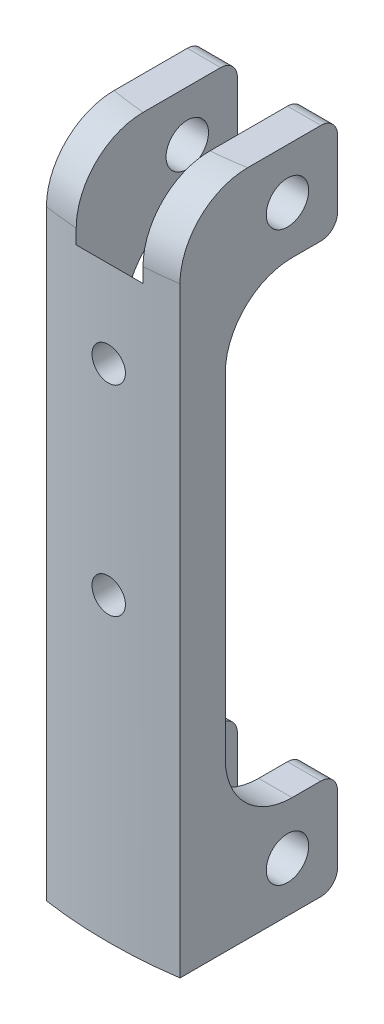
from build123d import *

# Parameters (mm, degrees)
SKETCH1_W               = 5
SKETCH1_H               = 5.034727375
SKETCH1_H_2             = 16.309288723
BOSS_EXTRUDE10_DEPTH    = 100
SKETCH17_W              = 16.809288723
SKETCH17_H              = 70
CUT_EXTRUDE1_DEPTH      = 25
FILLET1_R               = 10
FILLET2_R               = 2.5
FILLET3_R               = 10
SKETCH17_3_R            = 3.175
CUT_EXTRUDE2_DEPTH      = 25
CUT_EXTRUDE3_START      = -7.276812953
CUT_EXTRUDE3_OUTLINE_W  = 10
CUT_EXTRUDE3_OUTLINE_H  = 10
CUT_EXTRUDE3_DEPTH      = 8
CHAMFER1_SIZE           = 10
CUT_EXTRUDE4_DEPTH      = 104.229376725
CUT_EXTRUDE4_DEPTH_BACK = 20
SKETCH20_R              = 2.5


# Read off the part's stored shape, not the designer's step: Cut-Extrude3
with BuildPart() as part:
    # Sketch1 → Boss-Extrude10 (new body)
    with BuildSketch(Plane(origin=(0, 0, 0), x_dir=(1, 0, 0), z_dir=(0, 1, 0))):
        with BuildLine():
            Line((-5, -66.534727375), (-10, -66.534727375))
            Line((-10, -66.534727375), (-10, -66.755149614))
            ThreePointArc((-10, -66.755149614), (-7.505213856, -67.081456193), (-5, -67.314560089))
            Line((-5, -67.314560089), (-5, -66.534727375))
        make_face()
        with BuildLine():
            ThreePointArc((-5, -67.314560089), (-7.505213856, -67.081456193), (-10, -66.755149614))
            Line((-10, -66.755149614), (-10, -68.018839302))
            ThreePointArc((-10, -68.018839302), (-7.505023524, -68.339133166), (-5, -68.56794076))
            Line((-5, -68.56794076), (-5, -67.314560089))
        make_face()
        with BuildLine():
            ThreePointArc((10, -66.755149614), (7.505213856, -67.081456193), (5, -67.314560089))
            Line((5, -67.314560089), (5, -68.56794076))
            ThreePointArc((5, -68.56794076), (7.505023524, -68.339133166), (10, -68.018839302))
            Line((10, -68.018839302), (10, -66.755149614))
        make_face()
        with BuildLine():
            Line((5, -66.534727375), (5, -67.314560089))
            ThreePointArc((5, -67.314560089), (7.505213856, -67.081456193), (10, -66.755149614))
            Line((10, -66.755149614), (10, -66.534727375))
            Line((10, -66.534727375), (5, -66.534727375))
        make_face()
        with BuildLine():
            Line((0, -66.534727375), (-5, -66.534727375))
            Line((-5, -66.534727375), (-5, -67.314560089))
            ThreePointArc((-5, -67.314560089), (0, -67.5), (5, -67.314560089))
            Line((5, -67.314560089), (5, -66.534727375))
            Line((5, -66.534727375), (0, -66.534727375))
        make_face()
        with BuildLine():
            ThreePointArc((5, -67.314560089), (0, -67.5), (-5, -67.314560089))
            Line((-5, -67.314560089), (-5, -68.56794076))
            ThreePointArc((-5, -68.56794076), (0, -68.75), (5, -68.56794076))
            Line((5, -68.56794076), (5, -67.314560089))
        make_face()
        with Locations((7.5, -64.017363688)):
            Rectangle(SKETCH1_W, SKETCH1_H)
        with Locations((-7.5, -64.017363688)):
            Rectangle(SKETCH1_W, SKETCH1_H)
        Polygon((-5, -61.5), (-5, -66.534727375), (0, -66.534727375), (5, -66.534727375), (5, -61.5), align=None)
        with Locations((-7.5, -53.345355639)):
            Rectangle(SKETCH1_W, SKETCH1_H_2)
        with Locations((7.5, -53.345355639)):
            Rectangle(SKETCH1_W, SKETCH1_H_2)
        with BuildLine():
            ThreePointArc((-5, -68.56794076), (-7.505023524, -68.339133166), (-10, -68.018839302))
            Line((-10, -68.018839302), (-10, -68.776812953))
            ThreePointArc((-10, -68.776812953), (0, -69.5), (10, -68.776812953))
            Line((10, -68.776812953), (10, -68.018839302))
            ThreePointArc((10, -68.018839302), (7.505023524, -68.339133166), (5, -68.56794076))
            ThreePointArc((5, -68.56794076), (0, -68.75), (-5, -68.56794076))
        make_face()
    extrude(amount=BOSS_EXTRUDE10_DEPTH)

    # Sketch17 → Cut-Extrude1 (cut)
    with BuildSketch(Plane(origin=(10, 0, 0), x_dir=(0, 0, -1), z_dir=(1, 0, 0))):
        with Locations((-53.595355639, 50)):
            Rectangle(SKETCH17_W, SKETCH17_H)
    extrude(amount=-CUT_EXTRUDE1_DEPTH, mode=Mode.SUBTRACT)

    # Fillet1
    # the kernel refuses this fillet: 10 mm, written as the material it adds along each edge
    with BuildSketch(Plane(origin=(10, 15, 62), x_dir=(0, 0, -1), z_dir=(-1, 0, 0))) as fillet1_piece_1_section:
        with BuildLine():
            CenterArc((FILLET1_R, -FILLET1_R), FILLET1_R, 90, 90)
            Line((0, -FILLET1_R), (0, 0))
            Line((0, 0), (FILLET1_R, 0))
        make_face()
    fillet1_piece_1 = extrude(amount=20, mode=Mode.PRIVATE)
    fillet1_piece_1 = split(fillet1_piece_1, bisect_by=Plane(origin=(5, 16.64778747, 59.064177201), z_dir=(1, 0, 0)), keep=Keep.TOP, mode=Mode.PRIVATE)
    fillet1_piece_1 = split(fillet1_piece_1, bisect_by=Plane(origin=(7.5, 16.64778747, 61.5), z_dir=(0, 0, -1)), keep=Keep.TOP, mode=Mode.PRIVATE)
    add(fillet1_piece_1)
    with BuildSketch(Plane(origin=(10, 15, 62), x_dir=(0, 0, -1), z_dir=(-1, 0, 0))) as fillet1_piece_2_section:
        with BuildLine():
            CenterArc((FILLET1_R, -FILLET1_R), FILLET1_R, 90, 90)
            Line((0, -FILLET1_R), (0, 0))
            Line((0, 0), (FILLET1_R, 0))
        make_face()
    fillet1_piece_2 = extrude(amount=20, mode=Mode.PRIVATE)
    fillet1_piece_2 = split(fillet1_piece_2, bisect_by=Plane(origin=(5, 19.226172228, 61.875676343), z_dir=(1, 0, 0)), keep=Keep.TOP, mode=Mode.PRIVATE)
    fillet1_piece_2 = split(fillet1_piece_2, bisect_by=Plane(origin=(7.5, 19.226172228, 61.5), z_dir=(0, 0, 1)), keep=Keep.TOP, mode=Mode.PRIVATE)
    add(fillet1_piece_2)
    with BuildSketch(Plane(origin=(10, 15, 62), x_dir=(0, 0, -1), z_dir=(-1, 0, 0))) as fillet1_piece_3_section:
        with BuildLine():
            CenterArc((FILLET1_R, -FILLET1_R), FILLET1_R, 90, 90)
            Line((0, -FILLET1_R), (0, 0))
            Line((0, 0), (FILLET1_R, 0))
        make_face()
    fillet1_piece_3 = extrude(amount=20, mode=Mode.PRIVATE)
    fillet1_piece_3 = split(fillet1_piece_3, bisect_by=Plane(origin=(5, 19.226172228, 61.875676343), z_dir=(-1, 0, 0)), keep=Keep.TOP, mode=Mode.PRIVATE)
    fillet1_piece_3 = split(fillet1_piece_3, bisect_by=Plane(origin=(0, 19.226172228, 61.5), z_dir=(0, 0, 1)), keep=Keep.TOP, mode=Mode.PRIVATE)
    fillet1_piece_3 = split(fillet1_piece_3, bisect_by=Plane(origin=(-5, 19.226172228, 61.875676343), z_dir=(1, 0, 0)), keep=Keep.TOP, mode=Mode.PRIVATE)
    add(fillet1_piece_3)
    with BuildSketch(Plane(origin=(10, 15, 62), x_dir=(0, 0, -1), z_dir=(-1, 0, 0))) as fillet1_piece_4_section:
        with BuildLine():
            CenterArc((FILLET1_R, -FILLET1_R), FILLET1_R, 90, 90)
            Line((0, -FILLET1_R), (0, 0))
            Line((0, 0), (FILLET1_R, 0))
        make_face()
    fillet1_piece_4 = extrude(amount=20, mode=Mode.PRIVATE)
    fillet1_piece_4 = split(fillet1_piece_4, bisect_by=Plane(origin=(-7.5, 16.64778747, 61.5), z_dir=(0, 0, -1)), keep=Keep.TOP, mode=Mode.PRIVATE)
    fillet1_piece_4 = split(fillet1_piece_4, bisect_by=Plane(origin=(-5, 16.64778747, 59.064177201), z_dir=(-1, 0, 0)), keep=Keep.TOP, mode=Mode.PRIVATE)
    add(fillet1_piece_4)
    with BuildSketch(Plane(origin=(10, 15, 62), x_dir=(0, 0, -1), z_dir=(-1, 0, 0))) as fillet1_piece_5_section:
        with BuildLine():
            CenterArc((FILLET1_R, -FILLET1_R), FILLET1_R, 90, 90)
            Line((0, -FILLET1_R), (0, 0))
            Line((0, 0), (FILLET1_R, 0))
        make_face()
    fillet1_piece_5 = extrude(amount=20, mode=Mode.PRIVATE)
    fillet1_piece_5 = split(fillet1_piece_5, bisect_by=Plane(origin=(-7.5, 19.226172228, 61.5), z_dir=(0, 0, 1)), keep=Keep.TOP, mode=Mode.PRIVATE)
    fillet1_piece_5 = split(fillet1_piece_5, bisect_by=Plane(origin=(-5, 19.226172228, 61.875676343), z_dir=(-1, 0, 0)), keep=Keep.TOP, mode=Mode.PRIVATE)
    add(fillet1_piece_5)
    with BuildSketch(Plane(origin=(10, 85, 62), x_dir=(0, -1, 0), z_dir=(-1, 0, 0))) as fillet1_piece_6_section:
        with BuildLine():
            CenterArc((FILLET1_R, -FILLET1_R), FILLET1_R, 90, 90)
            Line((0, -FILLET1_R), (0, 0))
            Line((0, 0), (FILLET1_R, 0))
        make_face()
    fillet1_piece_6 = extrude(amount=20, mode=Mode.PRIVATE)
    fillet1_piece_6 = split(fillet1_piece_6, bisect_by=Plane(origin=(7.5, 80.773827772, 61.5), z_dir=(0, 0, 1)), keep=Keep.TOP, mode=Mode.PRIVATE)
    fillet1_piece_6 = split(fillet1_piece_6, bisect_by=Plane(origin=(5, 80.773827772, 61.875676343), z_dir=(1, 0, 0)), keep=Keep.TOP, mode=Mode.PRIVATE)
    add(fillet1_piece_6)
    with BuildSketch(Plane(origin=(10, 85, 62), x_dir=(0, -1, 0), z_dir=(-1, 0, 0))) as fillet1_piece_7_section:
        with BuildLine():
            CenterArc((FILLET1_R, -FILLET1_R), FILLET1_R, 90, 90)
            Line((0, -FILLET1_R), (0, 0))
            Line((0, 0), (FILLET1_R, 0))
        make_face()
    fillet1_piece_7 = extrude(amount=20, mode=Mode.PRIVATE)
    fillet1_piece_7 = split(fillet1_piece_7, bisect_by=Plane(origin=(7.5, 83.35221253, 61.5), z_dir=(0, 0, -1)), keep=Keep.TOP, mode=Mode.PRIVATE)
    fillet1_piece_7 = split(fillet1_piece_7, bisect_by=Plane(origin=(5, 83.35221253, 59.064177201), z_dir=(1, 0, 0)), keep=Keep.TOP, mode=Mode.PRIVATE)
    add(fillet1_piece_7)
    with BuildSketch(Plane(origin=(10, 85, 62), x_dir=(0, -1, 0), z_dir=(-1, 0, 0))) as fillet1_piece_8_section:
        with BuildLine():
            CenterArc((FILLET1_R, -FILLET1_R), FILLET1_R, 90, 90)
            Line((0, -FILLET1_R), (0, 0))
            Line((0, 0), (FILLET1_R, 0))
        make_face()
    fillet1_piece_8 = extrude(amount=20, mode=Mode.PRIVATE)
    fillet1_piece_8 = split(fillet1_piece_8, bisect_by=Plane(origin=(-5, 80.773827772, 61.875676343), z_dir=(1, 0, 0)), keep=Keep.TOP, mode=Mode.PRIVATE)
    fillet1_piece_8 = split(fillet1_piece_8, bisect_by=Plane(origin=(0, 80.773827772, 61.5), z_dir=(0, 0, 1)), keep=Keep.TOP, mode=Mode.PRIVATE)
    fillet1_piece_8 = split(fillet1_piece_8, bisect_by=Plane(origin=(5, 80.773827772, 61.875676343), z_dir=(-1, 0, 0)), keep=Keep.TOP, mode=Mode.PRIVATE)
    add(fillet1_piece_8)
    with BuildSketch(Plane(origin=(10, 85, 62), x_dir=(0, -1, 0), z_dir=(-1, 0, 0))) as fillet1_piece_9_section:
        with BuildLine():
            CenterArc((FILLET1_R, -FILLET1_R), FILLET1_R, 90, 90)
            Line((0, -FILLET1_R), (0, 0))
            Line((0, 0), (FILLET1_R, 0))
        make_face()
    fillet1_piece_9 = extrude(amount=20, mode=Mode.PRIVATE)
    fillet1_piece_9 = split(fillet1_piece_9, bisect_by=Plane(origin=(-5, 80.773827772, 61.875676343), z_dir=(-1, 0, 0)), keep=Keep.TOP, mode=Mode.PRIVATE)
    fillet1_piece_9 = split(fillet1_piece_9, bisect_by=Plane(origin=(-7.5, 80.773827772, 61.5), z_dir=(0, 0, 1)), keep=Keep.TOP, mode=Mode.PRIVATE)
    add(fillet1_piece_9)
    with BuildSketch(Plane(origin=(10, 85, 62), x_dir=(0, -1, 0), z_dir=(-1, 0, 0))) as fillet1_piece_10_section:
        with BuildLine():
            CenterArc((FILLET1_R, -FILLET1_R), FILLET1_R, 90, 90)
            Line((0, -FILLET1_R), (0, 0))
            Line((0, 0), (FILLET1_R, 0))
        make_face()
    fillet1_piece_10 = extrude(amount=20, mode=Mode.PRIVATE)
    fillet1_piece_10 = split(fillet1_piece_10, bisect_by=Plane(origin=(-5, 83.35221253, 59.064177201), z_dir=(-1, 0, 0)), keep=Keep.TOP, mode=Mode.PRIVATE)
    fillet1_piece_10 = split(fillet1_piece_10, bisect_by=Plane(origin=(-7.5, 83.35221253, 61.5), z_dir=(0, 0, -1)), keep=Keep.TOP, mode=Mode.PRIVATE)
    add(fillet1_piece_10)

    # Fillet2
    fillet2_edges = [part.edges().sort_by_distance(p)[0] for p in [
        (-7.5, 0, 45.190711277),
        (7.5, 0, 45.190711277),
        (7.5, 100, 45.190711277),
        (-7.5, 100, 45.190711277),
        (-7.5, 85, 45.190711277),
        (7.5, 85, 45.190711277),
        (7.5, 15, 45.190711277),
        (-7.5, 15, 45.190711277),
    ]]
    fillet(fillet2_edges, radius=FILLET2_R)

    # Fillet3
    # the kernel refuses this fillet: 10 mm, written as the material it takes off along each edge
    with BuildSketch(Plane(origin=(0, 100, 0), x_dir=(-0.4830223536282857, 0, 0.8756080206892758), z_dir=(-0.8756080206892758, 0, -0.4830223536282857))) as fillet3_piece_1:
        with BuildLine():
            CenterArc((69.5 - FILLET3_R, -FILLET3_R), FILLET3_R, 0, 90)
            Line((69.5, -FILLET3_R), (69.5, 0))
            Line((69.5, 0), (69.5 - FILLET3_R, 0))
        make_face()
    revolve(axis=Axis((0, 100, 0), (0, 1, 0)), revolution_arc=57.765966915, mode=Mode.SUBTRACT)

    # Sketch17<3> → Cut-Extrude2 (cut)
    with BuildSketch(Plane(origin=(10, 0, 0), x_dir=(0, 0, -1), z_dir=(1, 0, 0))):
        with Locations((-52.690711277, 92.5)):
            Circle(SKETCH17_3_R)
        with Locations((-52.690711277, 7.5)):
            Circle(SKETCH17_3_R)
    extrude(amount=-CUT_EXTRUDE2_DEPTH, mode=Mode.SUBTRACT)

    # Cut-Extrude3 outline → Cut-Extrude3 (cut)
    with BuildSketch(Plane.XY.offset(68.776812953).offset(CUT_EXTRUDE3_START)):
        with Locations((0, 95)):
            Rectangle(CUT_EXTRUDE3_OUTLINE_W, CUT_EXTRUDE3_OUTLINE_H)
    extrude(amount=CUT_EXTRUDE3_DEPTH, mode=Mode.SUBTRACT)

    # Chamfer1
    # the kernel refuses this chamfer: 10 mm, written as the material it takes off along each edge
    with BuildSketch(Plane(origin=(-5, 90, 61.5), x_dir=(0, 0.02749587661029838, 0.9996219169113046), z_dir=(1, 0, 0))) as chamfer1_piece_1:
        Polygon((CHAMFER1_SIZE * 0.999621916911, CHAMFER1_SIZE * 0.0274958766103), (-CHAMFER1_SIZE * 0.0274958766307, CHAMFER1_SIZE * 0.999621916911), (0, 0), align=None)
    extrude(amount=10, mode=Mode.SUBTRACT)

    # Sketch20 → Cut-Extrude4 (cut, two sides: drawn at the far end of the back side and taken through both)
    with BuildSketch(Plane.XY.offset(68.776812953).offset(-CUT_EXTRUDE4_DEPTH_BACK)):
        with Locations(Location((0, 75, 0), (0, 0, 180))):
            Circle(SKETCH20_R)
        with Locations(Location((0, 45, 0), (0, 0, 180))):
            Circle(SKETCH20_R)
    extrude(amount=CUT_EXTRUDE4_DEPTH + CUT_EXTRUDE4_DEPTH_BACK, mode=Mode.SUBTRACT)


solid = part.part
